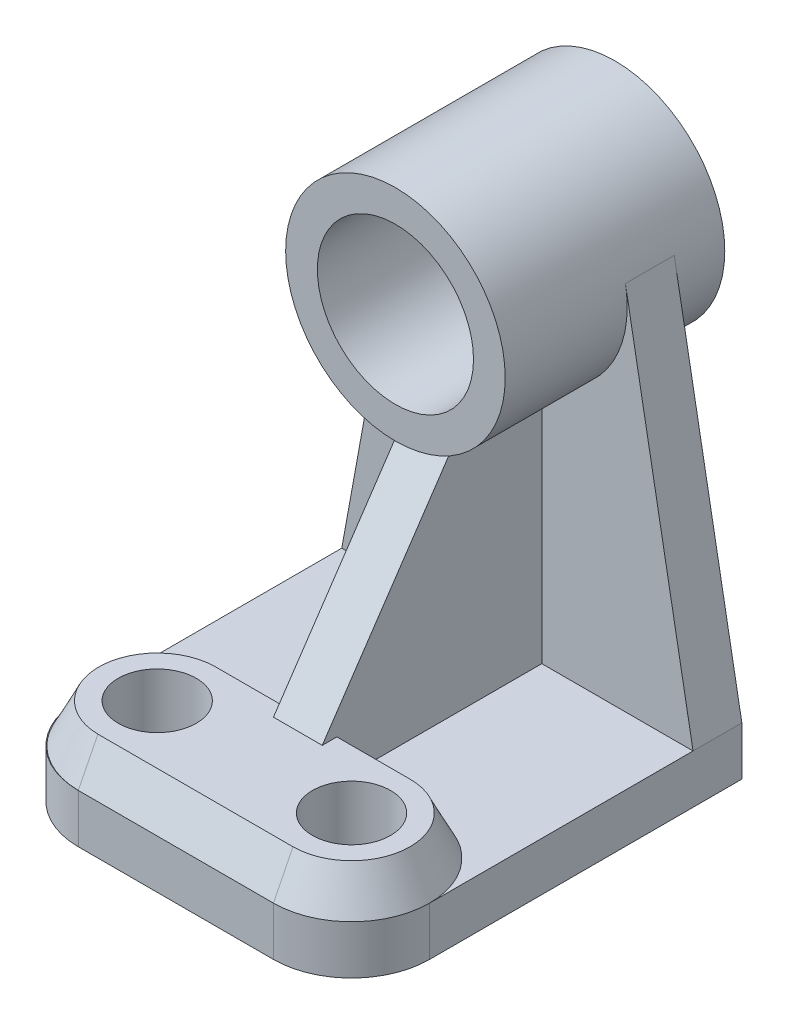
from build123d import *
from OCP.BRepFilletAPI import BRepFilletAPI_MakeChamfer

# Parameters (mm, degrees)
SKETCH1_W                               = 72
SKETCH1_H                               = 10
BOSS_EXTRUDE1_DEPTH                     = 80
BOSS_EXTRUDE2_DEPTH                     = 10
BOSS_EXTRUDE3_DEPTH                     = 35
BOSS_EXTRUDE3_DEPTH_BACK                = 10
SKETCH1_4_R                             = 22.5
SKETCH2_R                               = 8
BOSS_EXTRUDE4_DEPTH                     = 8
FILLET1_R                               = 16
CHAMFER4_SIZE                           = 8
CHAMFER4_SIZE_2                         = 4
SKETCH2_3_R                             = 8
CUT_EXTRUDE2_DEPTH                      = 129.942816783
RIB1_REACH                              = 134.651
SKETCH3_WALL_W                          = 317.36417602
SKETCH3_WALL_H                          = 10
CBORE_FOR_M5_HEX_HEAD_BOLT1_D           = 24
CBORE_FOR_M5_HEX_HEAD_BOLT1_DEPTH       = 45
CBORE_FOR_M5_HEX_HEAD_BOLT1_CBORE_D     = 32
CBORE_FOR_M5_HEX_HEAD_BOLT1_CBORE_DEPTH = 30
CBORE_FOR_M5_HEX_HEAD_BOLT1_TIP         = 6.92820323


with BuildPart() as part:
    # Sketch1 → Boss-Extrude1 (new body)
    with BuildSketch(Plane.XY):
        Rectangle(SKETCH1_W, SKETCH1_H)
    extrude(amount=BOSS_EXTRUDE1_DEPTH)

    # Sketch1<3> → Boss-Extrude2 (add)
    with BuildSketch(Plane.XY):
        with BuildLine():
            Line((-22.135009542, 81.036254771), (-36, 5))
            Line((-36, 5), (36, 5))
            Line((36, 5), (22.135009542, 81.036254771))
            ThreePointArc((22.135009542, 81.036254771), (22.408566606, 79.026361925), (22.5, 77))
            ThreePointArc((22.5, 77), (-2.026361925, 54.591433394), (-22.135009542, 81.036254771))
        make_face()
    extrude(amount=BOSS_EXTRUDE2_DEPTH)

    # Sketch1<4> → Boss-Extrude3 (add, two sides: drawn at the far end of the back side and taken through both)
    with BuildSketch(Plane.XY.offset(-BOSS_EXTRUDE3_DEPTH_BACK)):
        with Locations((0, 77)):
            Circle(SKETCH1_4_R)
    extrude(amount=BOSS_EXTRUDE3_DEPTH + BOSS_EXTRUDE3_DEPTH_BACK)

    # Sketch2 → Boss-Extrude4 (add)
    with BuildSketch(Plane(origin=(0, 5, 0), x_dir=(1, 0, 0), z_dir=(0, 1, 0))):
        with BuildLine():
            Line((-20, -80), (20, -80))
            ThreePointArc((20, -80), (36, -64), (20, -48))
            Line((20, -48), (-20, -48))
            ThreePointArc((-20, -48), (-35.817313754, -64), (-20, -80))
        make_face()
        with Locations(Location((20, -64, 0), (0, 0, 270))):
            Circle(SKETCH2_R, mode=Mode.SUBTRACT)
        with Locations(Location((-19.816258763, -64, 0), (0, 0, 270))):
            Circle(SKETCH2_R, mode=Mode.SUBTRACT)
    extrude(amount=BOSS_EXTRUDE4_DEPTH)

    # Fillet1
    fillet1_edges = [part.edges().sort_by_distance(p)[0] for p in [
        (-36, 0, 80),
        (36, 0, 80),
    ]]
    fillet(fillet1_edges, radius=FILLET1_R)

    # Chamfer4
    chamfer4_edges_1 = [part.edges().sort_by_distance(p)[0] for p in [
        (36, 13, 64),
    ]]
    chamfer4_side_1 = [part.faces().sort_by_distance(p)[0] for p in [
        (36, 12.92, 64),
    ]]
    chamfer4_edges_2 = [part.edges().sort_by_distance(p)[0] for p in [
        (0, 13, 48),
    ]]
    chamfer4_side_2 = [part.faces().sort_by_distance(p)[0] for p in [
        (0, 12.92, 48),
    ]]
    chamfer4_edges_3 = [part.edges().sort_by_distance(p)[0] for p in [
        (-35.817313754, 13, 64),
    ]]
    chamfer4_side_3 = [part.faces().sort_by_distance(p)[0] for p in [
        (-35.817313754, 12.92, 64),
    ]]
    chamfer4_edges_4 = [part.edges().sort_by_distance(p)[0] for p in [
        (0, 13, 80),
    ]]
    chamfer4_side_4 = [part.faces().sort_by_distance(p)[0] for p in [
        (0, 12.92, 80),
    ]]
    chamfer4 = BRepFilletAPI_MakeChamfer(part.part.solid().wrapped)
    for e in chamfer4_edges_1:
        chamfer4.Add(CHAMFER4_SIZE - 0.0001, CHAMFER4_SIZE_2 - 0.0001, e.wrapped, chamfer4_side_1[0].wrapped)
    for e in chamfer4_edges_2:
        chamfer4.Add(CHAMFER4_SIZE - 0.0001, CHAMFER4_SIZE_2 - 0.0001, e.wrapped, chamfer4_side_2[0].wrapped)
    for e in chamfer4_edges_3:
        chamfer4.Add(CHAMFER4_SIZE - 0.0001, CHAMFER4_SIZE_2 - 0.0001, e.wrapped, chamfer4_side_3[0].wrapped)
    for e in chamfer4_edges_4:
        chamfer4.Add(CHAMFER4_SIZE - 0.0001, CHAMFER4_SIZE_2 - 0.0001, e.wrapped, chamfer4_side_4[0].wrapped)
    add(Compound.cast(chamfer4.Shape()), mode=Mode.REPLACE)  # a hair under: the kernel refuses the full size

    # Sketch2<3> → Cut-Extrude2 (cut, through all)
    with BuildSketch(Plane(origin=(0, 5, 0), x_dir=(1, 0, 0), z_dir=(0, 1, 0))):
        with Locations(Location((-19.816258763, -64, 0), (0, 0, 270))):
            Circle(SKETCH2_3_R)
        with Locations(Location((20, -64, 0), (0, 0, 270))):
            Circle(SKETCH2_3_R)
    extrude(amount=-CUT_EXTRUDE2_DEPTH, mode=Mode.SUBTRACT)

    # Sketch3 wall → Rib1 (add, up to next)
    with BuildSketch(Plane(origin=(0, 33.75, 41), x_dir=(0, 0.828964441269, -0.559301309772), z_dir=(0, 0.559301309772, 0.828964441269)), mode=Mode.PRIVATE) as rib1_sk1:
        Rectangle(SKETCH3_WALL_W, SKETCH3_WALL_H)
    rib1_tool1 = extrude(rib1_sk1.sketch, amount=-RIB1_REACH, mode=Mode.PRIVATE) - part.part
    add(rib1_tool1.solids().sort_by_distance((0, 33.75, 41))[0])

    # CBORE for M5 Hex Head Bolt1
    with Locations(Plane.XY.offset(35)):
        with Locations((0, 77)):
            CounterBoreHole(CBORE_FOR_M5_HEX_HEAD_BOLT1_D / 2, CBORE_FOR_M5_HEX_HEAD_BOLT1_CBORE_D / 2, CBORE_FOR_M5_HEX_HEAD_BOLT1_CBORE_DEPTH, depth=CBORE_FOR_M5_HEX_HEAD_BOLT1_DEPTH)
            with Locations((0, 0, -(CBORE_FOR_M5_HEX_HEAD_BOLT1_DEPTH + CBORE_FOR_M5_HEX_HEAD_BOLT1_TIP / 2))):  # 120° drill point
                Cone(0, CBORE_FOR_M5_HEX_HEAD_BOLT1_D / 2, CBORE_FOR_M5_HEX_HEAD_BOLT1_TIP, mode=Mode.SUBTRACT)


solid = part.part
